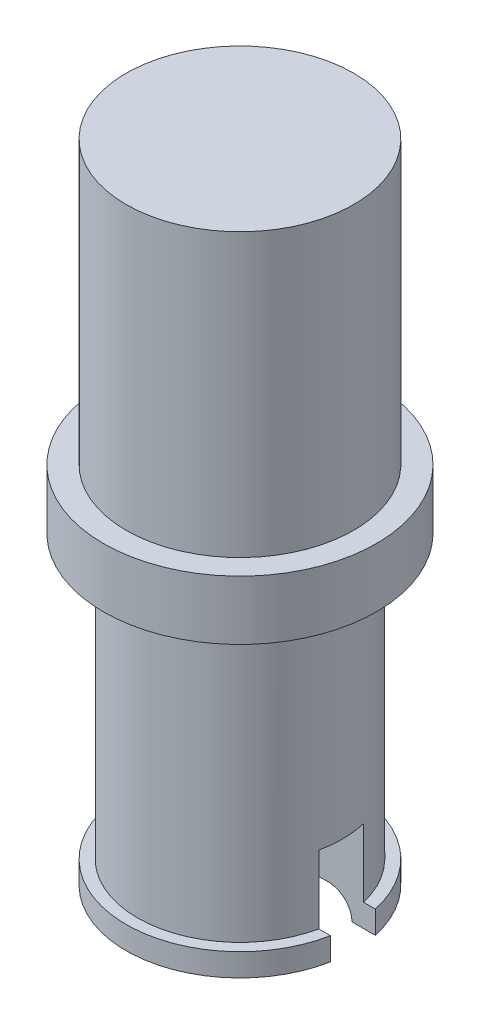
from build123d import *

# Parameters (mm, degrees)
SKETCH1_R           = 2.5
SKETCH1_R_2         = 2
BOSS_EXTRUDE1_DEPTH = 0.5
SKETCH3_R           = 2.25
SKETCH3_R_2         = 1.25
BOSS_EXTRUDE2_DEPTH = 6.2
SKETCH5_R           = 3
BOSS_EXTRUDE3_DEPTH = 1.3
SKETCH6_R           = 2.5
BOSS_EXTRUDE4_DEPTH = 6.2
SKETCH24_W          = 5.284246403
SKETCH24_H          = 1
CUT_EXTRUDE1_DEPTH  = 2
FILLET1_R           = 0.5


with BuildPart() as part:
    # Sketch1 → Boss-Extrude1 (new body)
    with BuildSketch(Plane(origin=(0, 0, 0), x_dir=(1, 0, 0), z_dir=(0, 1, 0))):
        with Locations(Location((0, 0, 0), (0, 0, 270))):
            Circle(SKETCH1_R)
        with Locations(Location((0, 0, 0), (0, 0, 270))):
            Circle(SKETCH1_R_2, mode=Mode.SUBTRACT)
    extrude(amount=BOSS_EXTRUDE1_DEPTH)

    # Sketch3 → Boss-Extrude2 (add)
    with BuildSketch(Plane(origin=(0, 0.5, 0), x_dir=(1, 0, 0), z_dir=(0, 1, 0))):
        with Locations(Location((0, 0, 0), (0, 0, 90))):
            Circle(SKETCH3_R)
        with Locations(Location((0, 0, 0), (0, 0, 90))):
            Circle(SKETCH3_R_2, mode=Mode.SUBTRACT)
    extrude(amount=BOSS_EXTRUDE2_DEPTH)

    # Sketch5 → Boss-Extrude3 (add)
    with BuildSketch(Plane(origin=(0, 6.7, 0), x_dir=(1, 0, 0), z_dir=(0, 1, 0))):
        with Locations(Location((0, 0, 0), (0, 0, 270))):
            Circle(SKETCH5_R)
    extrude(amount=BOSS_EXTRUDE3_DEPTH)

    # Sketch6 → Boss-Extrude4 (add)
    with BuildSketch(Plane(origin=(0, 8, 0), x_dir=(1, 0, 0), z_dir=(0, 1, 0))):
        with Locations(Location((0, 0, 0), (0, 0, 270))):
            Circle(SKETCH6_R)
    extrude(amount=BOSS_EXTRUDE4_DEPTH)

    # Sketch24 → Cut-Extrude1 (cut)
    with BuildSketch(Plane(origin=(0, 0, 0), x_dir=(-1, 0, 0), z_dir=(0, -1, 0))):
        with Locations((-0.034581621, 0.031508974)):
            Rectangle(SKETCH24_W, SKETCH24_H)
    extrude(amount=-CUT_EXTRUDE1_DEPTH, mode=Mode.SUBTRACT)

    # Fillet1
    fillet1_edges = [part.edges().sort_by_distance(p)[0] for p in [
        (0, 0.5, 2),
        (0, 0.5, -2),
    ]]
    fillet(fillet1_edges, radius=FILLET1_R - 0.0001)  # a hair under: the kernel refuses the full size


solid = part.part
